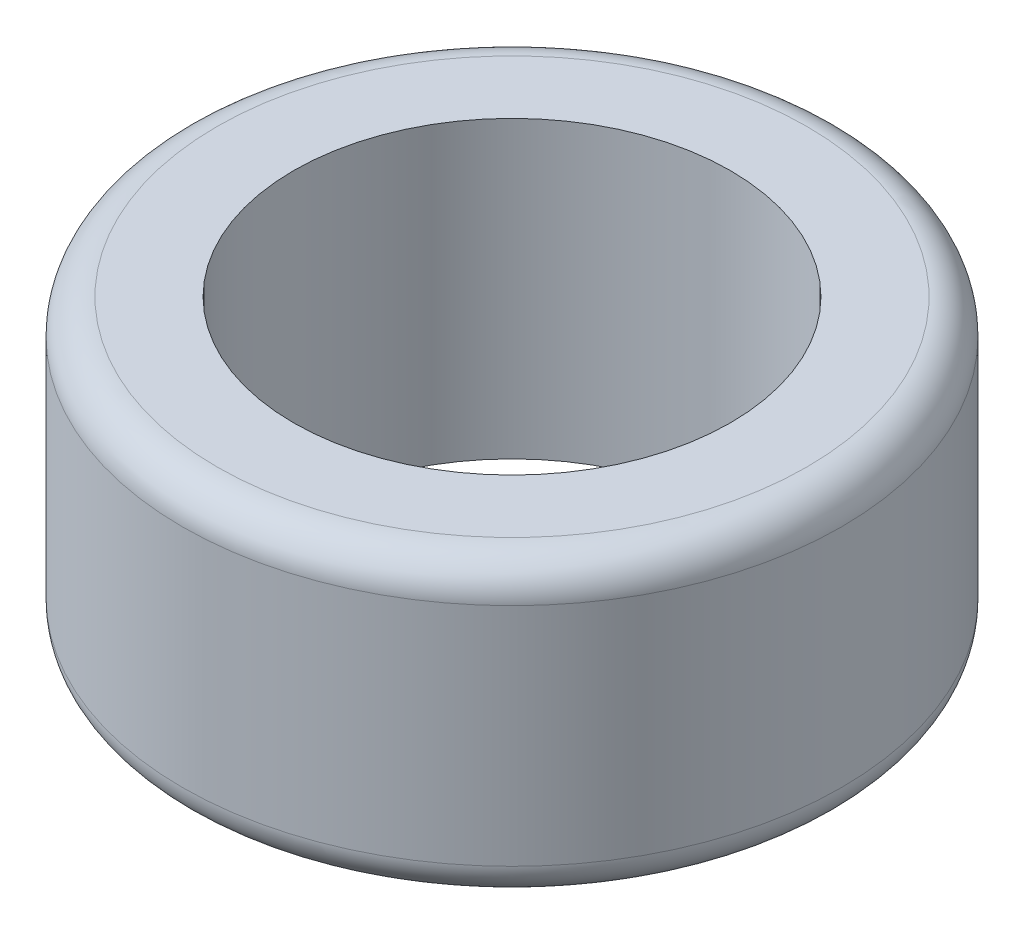
from build123d import *


with BuildPart() as part:
    # Sketch4 → Revolve1 (revolve)
    with BuildSketch(Plane.XY):
        with BuildLine():
            Line((-152.4, 0), (-152.4, 205.74))
            Line((-152.4, 205.74), (-205.74, 205.74))
            ThreePointArc((-205.74, 205.74), (-222.80248663, 198.67248663), (-229.87, 181.61))
            Line((-229.87, 181.61), (-229.87, 24.13))
            ThreePointArc((-229.87, 24.13), (-222.80248663, 7.06751337), (-205.74, 0))
            Line((-205.74, 0), (-152.4, 0))
        make_face()
    revolve(axis=Axis((0, 0, 0), (0, 1, 0)))


solid = part.part
